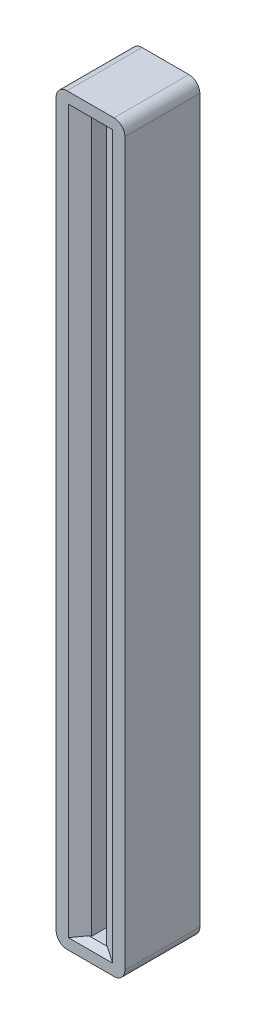
from build123d import *

# Parameters (mm, degrees)
SKETCH2_W          = 10.033
SKETCH2_H          = 108.585
EXTRUDE2_DEPTH     = 10.9474
FILLET1_R          = 1.5875
SKETCH7_W          = 2.159
SKETCH7_H          = 104.14
CUT_EXTRUDE2_DEPTH = 6.731
CHAMFER1_SIZE      = 2.159
CHAMFER1_SIZE2     = 1.246499231
CHAMFER2_SIZE      = 0.635
CHAMFER2_SIZE2     = 1.099852263


with BuildPart() as part:
    # Sketch2 → Extrude2 (new body)
    with BuildSketch(Plane.XY):
        Rectangle(SKETCH2_W, SKETCH2_H)
    extrude(amount=EXTRUDE2_DEPTH)

    # Fillet1
    fillet1_edges = [part.edges().sort_by_distance(p)[0] for p in [
        (5.0165, 54.2925, 5.4737),
        (5.0165, -54.2925, 5.4737),
        (-5.0165, -54.2925, 5.4737),
        (-5.0165, 54.2925, 5.4737),
    ]]
    fillet(fillet1_edges, radius=FILLET1_R)

    # Sketch7 → Cut-Extrude2 (cut)
    with BuildSketch(Plane.XY.offset(10.9474)):
        Rectangle(SKETCH7_W, SKETCH7_H)
    extrude(amount=-CUT_EXTRUDE2_DEPTH, mode=Mode.SUBTRACT)

    # Chamfer1
    chamfer1_edges = [part.edges().sort_by_distance(p)[0] for p in [
        (1.0795, 0, 10.9474),
        (-1.0795, 0, 10.9474),
    ]]
    chamfer1_side = [part.faces().sort_by_distance(p)[0] for p in [
        (0, 53.202024722, 10.9474),
    ]]
    chamfer(chamfer1_edges, length=CHAMFER1_SIZE, length2=CHAMFER1_SIZE2, reference=chamfer1_side[0])

    # Chamfer2
    chamfer2_edges = [part.edges().sort_by_distance(p)[0] for p in [
        (0, 52.07, 10.9474),
        (0, -52.07, 10.9474),
    ]]
    chamfer2_side = [part.faces().sort_by_distance(p)[0] for p in [
        (0, -53.160475278, 10.9474),
    ]]
    chamfer(chamfer2_edges, length=CHAMFER2_SIZE, length2=CHAMFER2_SIZE2, reference=chamfer2_side[0])


solid = part.part
